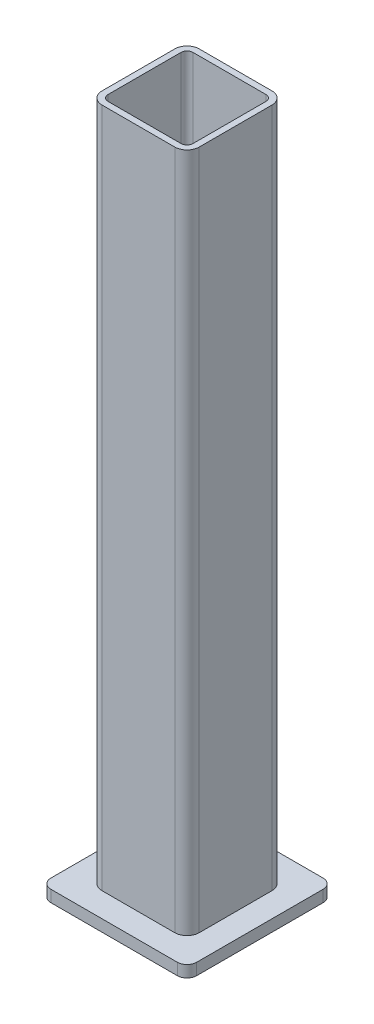
from build123d import *

# Parameters (mm, degrees)
TUBE_SQUARE_100_X_100_X_6_3_1_DEPTH = 700
SKETCH12_W                          = 150
SKETCH12_H                          = 150
BASE_FLANGE1_DEPTH                  = 12
BREAK_CORNER1_START                 = -12
BREAK_CORNER1_DEPTH                 = 12


# Read off the part's stored shape, not the designer's step: Break-Corner1
# Sheet-metal steps are written as plain solids
with BuildPart() as part:
    # Sketch11 → Tube (square) 100 X 100 X 6.3(1) (new body)
    with BuildSketch(Plane(origin=(0, 0, 0), x_dir=(-1, 0, 0), z_dir=(0, 1, 0))):
        with BuildLine():
            Line((-37.4, -50), (37.4, -50))
            ThreePointArc((37.4, -50), (46.309545443, -46.309545443), (50, -37.4))
            Line((50, -37.4), (50, 37.4))
            ThreePointArc((50, 37.4), (46.309545443, 46.309545443), (37.4, 50))
            Line((37.4, 50), (-37.4, 50))
            ThreePointArc((-37.4, 50), (-46.309545443, 46.309545443), (-50, 37.4))
            Line((-50, 37.4), (-50, -37.4))
            ThreePointArc((-50, -37.4), (-46.309545443, -46.309545443), (-37.4, -50))
        make_face()
        with BuildLine():
            Line((-37.4, -43.7), (37.4, -43.7))
            ThreePointArc((37.4, -43.7), (41.854772721, -41.854772721), (43.7, -37.4))
            Line((43.7, -37.4), (43.7, 37.4))
            ThreePointArc((43.7, 37.4), (41.854772721, 41.854772721), (37.4, 43.7))
            Line((37.4, 43.7), (-37.4, 43.7))
            ThreePointArc((-37.4, 43.7), (-41.854772721, 41.854772721), (-43.7, 37.4))
            Line((-43.7, 37.4), (-43.7, -37.4))
            ThreePointArc((-43.7, -37.4), (-41.854772721, -41.854772721), (-37.4, -43.7))
        make_face(mode=Mode.SUBTRACT)
    extrude(amount=TUBE_SQUARE_100_X_100_X_6_3_1_DEPTH)


with BuildPart() as body_2:
    # Sketch12 → Base-Flange1 (new body)
    with BuildSketch(Plane.XZ):
        Rectangle(SKETCH12_W, SKETCH12_H)
    extrude(amount=BASE_FLANGE1_DEPTH)

    # Break-Corner1 outline → Break-Corner1 (cut)
    with BuildSketch(Plane(origin=(0, 0, 0), x_dir=(1, 0, 0), z_dir=(0, 1, 0)).offset(BREAK_CORNER1_START)):
        with BuildLine():
            ThreePointArc((-75, 65), (-72.071067812, 72.071067812), (-65, 75))
            Line((-65, 75), (-75, 75))
            Line((-75, 75), (-75, 65))
        make_face()
        with BuildLine():
            Line((75, 75), (65, 75))
            ThreePointArc((65, 75), (72.071067812, 72.071067812), (75, 65))
            Line((75, 65), (75, 75))
        make_face()
        with BuildLine():
            ThreePointArc((-65, -75), (-72.071067812, -72.071067812), (-75, -65))
            Line((-75, -65), (-75, -75))
            Line((-75, -75), (-65, -75))
        make_face()
        with BuildLine():
            Line((75, -75), (75, -65))
            ThreePointArc((75, -65), (72.071067812, -72.071067812), (65, -75))
            Line((65, -75), (75, -75))
        make_face()
    extrude(amount=BREAK_CORNER1_DEPTH, mode=Mode.SUBTRACT)


solid = Compound([part.part, body_2.part])
